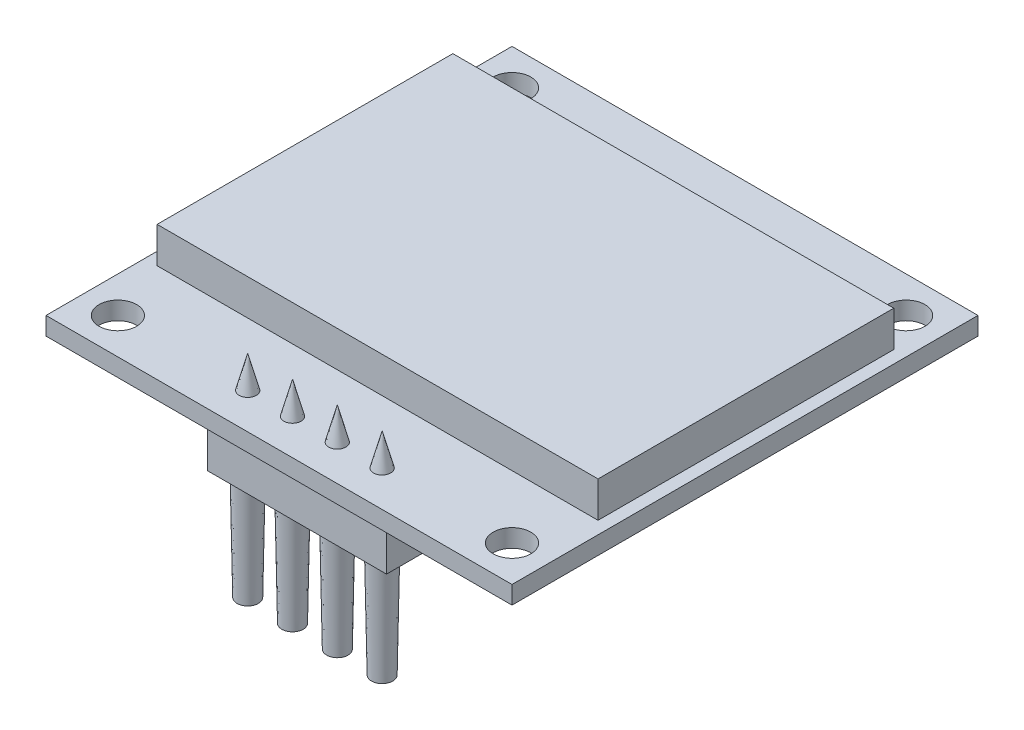
from build123d import *

# Parameters (mm, degrees)
SCHIZZO1_W                             = 26
SCHIZZO1_H                             = 26
SCHIZZO1_R                             = 1.05
ESTRUSIONE_ESTRUSIONE1_DEPTH           = 1
SCHIZZO1_3_W                           = 24.6
SCHIZZO1_3_H                           = 16.5
ESTRUSIONE_ESTRUSIONE2_DEPTH           = 3
SCHIZZO3_W                             = 10
SCHIZZO3_H                             = 2
ESTRUSIONE_ESTRUSIONE4_DEPTH           = 3
SCHIZZO1_5_R                           = 0.75
ESTRUSIONE_ESTRUSIONE5_DEPTH           = 9
ESTRUSIONE_ESTRUSIONE5_DRAFT           = -1
ESTRUSIONE_ESTRUSIONE5_PROFILE_2_DEPTH = 9
ESTRUSIONE_ESTRUSIONE5_PROFILE_2_DRAFT = -1
ESTRUSIONE_ESTRUSIONE5_PROFILE_3_DEPTH = 9
ESTRUSIONE_ESTRUSIONE5_PROFILE_3_DRAFT = -1
ESTRUSIONE_ESTRUSIONE5_PROFILE_4_DEPTH = 9
ESTRUSIONE_ESTRUSIONE5_PROFILE_4_DRAFT = -1


with BuildPart() as part:
    # Schizzo1 → Estrusione-Estrusione1 (new body)
    with BuildSketch(Plane(origin=(0, 0, 0), x_dir=(1, 0, 0), z_dir=(0, 1, 0))):
        Rectangle(SCHIZZO1_W, SCHIZZO1_H)
        with Locations((10.995510447, 10.995510447)):
            Circle(SCHIZZO1_R, mode=Mode.SUBTRACT)
        with Locations((10.995510447, -10.995510447)):
            Circle(SCHIZZO1_R, mode=Mode.SUBTRACT)
        with Locations((-10.995510447, -10.995510447)):
            Circle(SCHIZZO1_R, mode=Mode.SUBTRACT)
        with Locations((-10.995510447, 10.995510447)):
            Circle(SCHIZZO1_R, mode=Mode.SUBTRACT)
    extrude(amount=ESTRUSIONE_ESTRUSIONE1_DEPTH)


with BuildPart() as body_2:
    # Schizzo1<3> → Estrusione-Estrusione2 (new body)
    with BuildSketch(Plane(origin=(0, 0, 0), x_dir=(1, 0, 0), z_dir=(0, 1, 0))):
        with Locations((0, 0.75)):
            Rectangle(SCHIZZO1_3_W, SCHIZZO1_3_H)
    extrude(amount=ESTRUSIONE_ESTRUSIONE2_DEPTH)


with BuildPart() as body_3:
    # Estrusione-Estrusione3 cone 1 section (through the dimple's axis) → Estrusione-Estrusione3 (revolve)
    with BuildSketch(Plane(origin=(-3.75, 0, 10.995510447), x_dir=(0, 0, -1), z_dir=(1, 0, 0))):
        Polygon((0, 0), (0.75, 0), (0, 2.799038106), align=None)
    revolve(axis=Axis((-3.75, 0, 10.995510447), (0, 1, 0)))


with BuildPart() as body_4:
    # Estrusione-Estrusione3 cone 2 section (through the dimple's axis) → Estrusione-Estrusione3 cone 2 (revolve)
    with BuildSketch(Plane(origin=(-1.25, 0, 10.995510447), x_dir=(0, 0, -1), z_dir=(1, 0, 0))):
        Polygon((0, 0), (0.75, 0), (0, 2.799038106), align=None)
    revolve(axis=Axis((-1.25, 0, 10.995510447), (0, 1, 0)))


with BuildPart() as body_5:
    # Estrusione-Estrusione3 cone 3 section (through the dimple's axis) → Estrusione-Estrusione3 cone 3 (revolve)
    with BuildSketch(Plane(origin=(1.25, 0, 10.995510447), x_dir=(0, 0, -1), z_dir=(1, 0, 0))):
        Polygon((0, 0), (0.75, 0), (0, 2.799038106), align=None)
    revolve(axis=Axis((1.25, 0, 10.995510447), (0, 1, 0)))


with BuildPart() as body_6:
    # Estrusione-Estrusione3 cone 4 section (through the dimple's axis) → Estrusione-Estrusione3 cone 4 (revolve)
    with BuildSketch(Plane(origin=(3.75, 0, 10.995510447), x_dir=(0, 0, -1), z_dir=(1, 0, 0))):
        Polygon((0, 0), (0.75, 0), (0, 2.799038106), align=None)
    revolve(axis=Axis((3.75, 0, 10.995510447), (0, 1, 0)))


with BuildPart() as body_7:
    # Schizzo3 → Estrusione-Estrusione4 (new body)
    with BuildSketch(Plane(origin=(0, 0, 0), x_dir=(1, 0, 0), z_dir=(0, 1, 0))):
        with Locations((0, -11)):
            Rectangle(SCHIZZO3_W, SCHIZZO3_H)
    extrude(amount=-ESTRUSIONE_ESTRUSIONE4_DEPTH)


with BuildPart() as body_8:
    # Schizzo1<5> → Estrusione-Estrusione5 (with draft: the straight prism first)
    with BuildSketch(Plane(origin=(0, 0, 0), x_dir=(1, 0, 0), z_dir=(0, 1, 0))):
        with Locations((-3.75, -10.995510447)):
            Circle(SCHIZZO1_5_R)
    extrude(amount=-ESTRUSIONE_ESTRUSIONE5_DEPTH)
    # Estrusione-Estrusione5: the draft: its side faces are tilted about the plane it starts from
    estrusione_estrusione5_sides = [body_8.faces().sort_by_distance(p)[0] for p in [
        (-4.5, -4.5, 10.995510447),
    ]]
    draft(estrusione_estrusione5_sides, Plane(origin=(0, 0, 0), x_dir=(1, 0, 0), z_dir=(0, 1, 0)), ESTRUSIONE_ESTRUSIONE5_DRAFT)


with BuildPart() as body_9:
    # Schizzo1<5> → Estrusione-Estrusione5 profile 2 (with draft: the straight prism first)
    with BuildSketch(Plane(origin=(0, 0, 0), x_dir=(1, 0, 0), z_dir=(0, 1, 0))):
        with Locations((-1.25, -10.995510447)):
            Circle(SCHIZZO1_5_R)
    extrude(amount=-ESTRUSIONE_ESTRUSIONE5_PROFILE_2_DEPTH)
    # Estrusione-Estrusione5 profile 2: the draft: its side faces are tilted about the plane it starts from
    estrusione_estrusione5_profile_2_sides = [body_9.faces().sort_by_distance(p)[0] for p in [
        (-2, -4.5, 10.995510447),
    ]]
    draft(estrusione_estrusione5_profile_2_sides, Plane(origin=(0, 0, 0), x_dir=(1, 0, 0), z_dir=(0, 1, 0)), ESTRUSIONE_ESTRUSIONE5_PROFILE_2_DRAFT)


with BuildPart() as body_10:
    # Schizzo1<5> → Estrusione-Estrusione5 profile 3 (with draft: the straight prism first)
    with BuildSketch(Plane(origin=(0, 0, 0), x_dir=(1, 0, 0), z_dir=(0, 1, 0))):
        with Locations((1.25, -10.995510447)):
            Circle(SCHIZZO1_5_R)
    extrude(amount=-ESTRUSIONE_ESTRUSIONE5_PROFILE_3_DEPTH)
    # Estrusione-Estrusione5 profile 3: the draft: its side faces are tilted about the plane it starts from
    estrusione_estrusione5_profile_3_sides = [body_10.faces().sort_by_distance(p)[0] for p in [
        (0.5, -4.5, 10.995510447),
    ]]
    draft(estrusione_estrusione5_profile_3_sides, Plane(origin=(0, 0, 0), x_dir=(1, 0, 0), z_dir=(0, 1, 0)), ESTRUSIONE_ESTRUSIONE5_PROFILE_3_DRAFT)


with BuildPart() as body_11:
    # Schizzo1<5> → Estrusione-Estrusione5 profile 4 (with draft: the straight prism first)
    with BuildSketch(Plane(origin=(0, 0, 0), x_dir=(1, 0, 0), z_dir=(0, 1, 0))):
        with Locations((3.75, -10.995510447)):
            Circle(SCHIZZO1_5_R)
    extrude(amount=-ESTRUSIONE_ESTRUSIONE5_PROFILE_4_DEPTH)
    # Estrusione-Estrusione5 profile 4: the draft: its side faces are tilted about the plane it starts from
    estrusione_estrusione5_profile_4_sides = [body_11.faces().sort_by_distance(p)[0] for p in [
        (3, -4.5, 10.995510447),
    ]]
    draft(estrusione_estrusione5_profile_4_sides, Plane(origin=(0, 0, 0), x_dir=(1, 0, 0), z_dir=(0, 1, 0)), ESTRUSIONE_ESTRUSIONE5_PROFILE_4_DRAFT)


solid = Compound([part.part, body_2.part, body_3.part, body_4.part, body_5.part, body_6.part, body_7.part, body_8.part, body_9.part, body_10.part, body_11.part])
